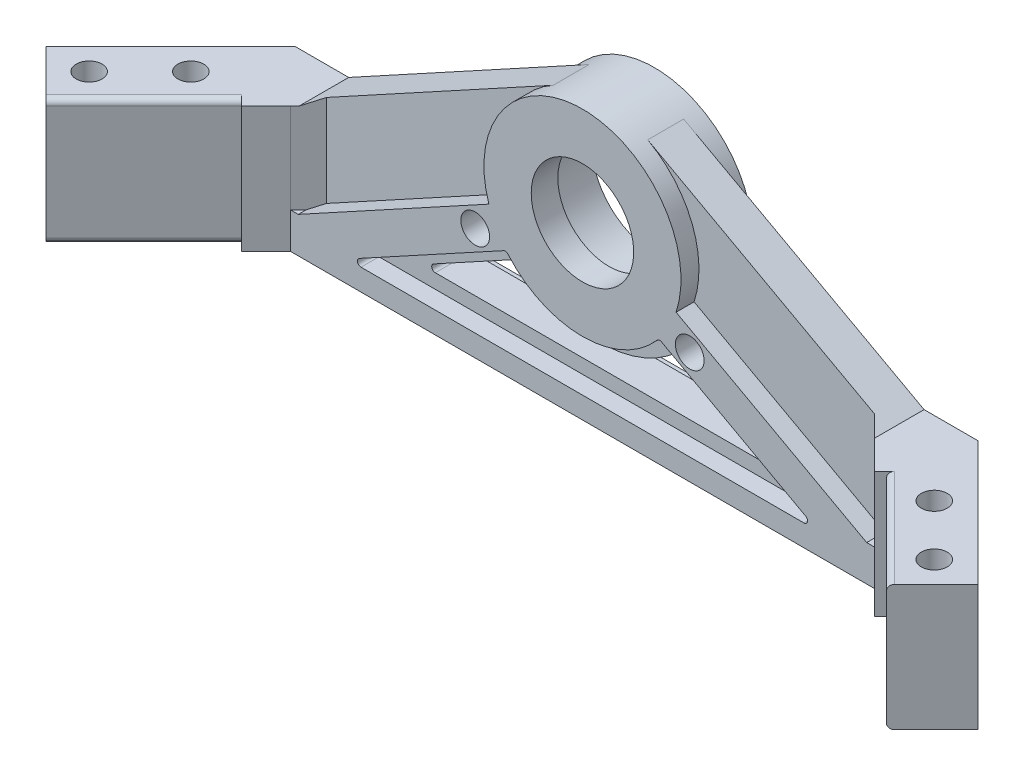
from build123d import *

# Parameters (mm, degrees)
BOSS_EXTRUDE1_DEPTH = 11.1125
BOSS_EXTRUDE2_DEPTH = 12.7
CUT_EXTRUDE2_DEPTH  = 8
CUT_EXTRUDE3_DEPTH  = 96.942967533
SKETCH5_W           = 25.144717139
SKETCH5_H           = 15.875
CUT_EXTRUDE4_DEPTH  = 3.175
CUT_EXTRUDE5_DEPTH  = 96.942967533
SKETCH6_R           = 2.54
CUT_EXTRUDE6_DEPTH  = 96.942967533
CUT_EXTRUDE7_START  = -3.175
CUT_EXTRUDE7_DEPTH  = 3.175
CHAMFER1_SIZE       = 3.175
FILLET1_R           = 0.635
FILLET3_R           = 1.016
SKETCH8_R           = 2.286
CUT_EXTRUDE8_DEPTH  = 93.295392221


with BuildPart() as part:
    # Sketch3 → Boss-Extrude1 (new, symmetric)
    with BuildSketch(Plane(origin=(0, 0, 0), x_dir=(1, 0, 0), z_dir=(0, 1, 0))):
        Polygon((-56.934473853, -15.948934871), (-65.016704362, -7.866704362), (-82.294717139, -25.144717139), (-74.93090712, -32.508527158), (-74.21248663, -33.226947648), align=None)
        Polygon((-65.016704362, -7.866704362), (-55.873813681, -17.009595043), (-52.371513794, -13.507295156), (-61.514404475, -4.364404475), align=None)
        Polygon((-52.371513794, -13.507295156), (-51.564218639, -12.7), (-17.311249955, -12.7), (0, -12.7), (0, 0), (-17.311249955, 0), (-57.15, 0), (-60.325, -3.175), (-61.514404475, -4.364404475), align=None)
        Polygon((0, 0), (0, -12.7), (17.311249955, -12.7), (51.564218639, -12.7), (52.371513794, -13.507295156), (61.514404475, -4.364404475), (60.325, -3.175), (57.15, 0), (17.311249955, 0), align=None)
        Polygon((61.514404475, -4.364404475), (65.016704362, -7.866704362), (55.873813681, -17.009595043), (52.371513794, -13.507295156), align=None)
        Polygon((65.016704362, -7.866704362), (56.934473853, -15.948934871), (74.21248663, -33.226947648), (74.93090712, -32.508527158), (82.294717139, -25.144717139), align=None)
    extrude(amount=BOSS_EXTRUDE1_DEPTH, both=True)

    # Sketch2 → Boss-Extrude2 (add)
    with BuildSketch(Plane.XY):
        with BuildLine():
            Line((-50.804788276, 11.1125), (50.804788276, 11.1125))
            Line((50.804788276, 11.1125), (8.344749207, 34.318436746))
            ThreePointArc((8.344749207, 34.318436746), (0, 36.45), (-8.344749207, 34.318436746))
            Line((-8.344749207, 34.318436746), (-50.804788276, 11.1125))
        make_face()
    extrude(amount=BOSS_EXTRUDE2_DEPTH)

    # Sketch2<3> → Cut-Extrude2 (cut)
    with BuildSketch(Plane.XY):
        with BuildLine():
            ThreePointArc((0, 30.1), (-11.05, 19.05), (0, 8))
            Line((0, 8), (0, 10))
            ThreePointArc((0, 10), (-9.05, 19.05), (0, 28.1))
            Line((0, 28.1), (0, 30.1))
        make_face()
        with BuildLine():
            Line((0, 10), (0, 8))
            ThreePointArc((0, 8), (7.813529932, 11.236470068), (11.05, 19.05))
            ThreePointArc((11.05, 19.05), (7.813529932, 26.863529932), (0, 30.1))
            Line((0, 30.1), (0, 28.1))
            ThreePointArc((0, 28.1), (6.39931637, 25.44931637), (9.05, 19.05))
            ThreePointArc((9.05, 19.05), (6.39931637, 12.65068363), (0, 10))
        make_face()
        with BuildLine():
            ThreePointArc((0, 28.1), (-9.05, 19.05), (0, 10))
            Line((0, 10), (0, 28.1))
        make_face()
        with BuildLine():
            Line((0, 28.1), (0, 10))
            ThreePointArc((0, 10), (6.39931637, 12.65068363), (9.05, 19.05))
            ThreePointArc((9.05, 19.05), (6.39931637, 25.44931637), (0, 28.1))
        make_face()
    extrude(amount=CUT_EXTRUDE2_DEPTH, mode=Mode.SUBTRACT)

    # Sketch2<5> → Cut-Extrude3 (cut, through all)
    with BuildSketch(Plane.XY):
        with BuildLine():
            ThreePointArc((0, 28.1), (-9.05, 19.05), (0, 10))
            Line((0, 10), (0, 28.1))
        make_face()
        with BuildLine():
            Line((0, 28.1), (0, 10))
            ThreePointArc((0, 10), (6.39931637, 12.65068363), (9.05, 19.05))
            ThreePointArc((9.05, 19.05), (6.39931637, 25.44931637), (0, 28.1))
        make_face()
    extrude(amount=CUT_EXTRUDE3_DEPTH, mode=Mode.SUBTRACT)

    # Sketch5 → Cut-Extrude4 (cut)
    # profile 1 of 5: a face of its own
    with BuildSketch(Plane(origin=(0, 0, 0), x_dir=(-1, 0, 0), z_dir=(0, 0, -1))):
        with Locations((-69.72235857, 3.175)):
            Rectangle(SKETCH5_W, SKETCH5_H)
    # profile 2 of 5: a face of its own
    with BuildSketch(Plane(origin=(0, 0, 0), x_dir=(-1, 0, 0), z_dir=(0, 0, -1))):
        with BuildLine():
            Line((-50.190202202, -4.7625), (-16.534774751, 13.631400187))
            ThreePointArc((-16.534774751, 13.631400187), (-16.178258512, 25.454994263), (-8.344749207, 34.318436746))
            Line((-8.344749207, 34.318436746), (-50.804788276, 11.1125))
            Line((-50.804788276, 11.1125), (-57.15, 11.1125))
            Line((-57.15, 11.1125), (-57.15, -4.7625))
            Line((-57.15, -4.7625), (-50.190202202, -4.7625))
        make_face()
    # profile 3 of 5: a face of its own
    with BuildSketch(Plane(origin=(0, 0, 0), x_dir=(-1, 0, 0), z_dir=(0, 0, -1))):
        with BuildLine():
            Line((50.804788276, 11.1125), (8.344749207, 34.318436746))
            ThreePointArc((8.344749207, 34.318436746), (14.965938597, 27.925848236), (17.4, 19.05))
            ThreePointArc((17.4, 19.05), (17.182332215, 16.306378367), (16.534774751, 13.631400187))
            Line((16.534774751, 13.631400187), (50.190202202, -4.7625))
            Line((50.190202202, -4.7625), (57.15, -4.7625))
            Line((57.15, -4.7625), (57.15, 11.1125))
            Line((57.15, 11.1125), (50.804788276, 11.1125))
        make_face()
    # profile 4 of 5: a face of its own
    with BuildSketch(Plane(origin=(0, 0, 0), x_dir=(-1, 0, 0), z_dir=(0, 0, -1))):
        with Locations((69.72235857, 3.175)):
            Rectangle(SKETCH5_W, SKETCH5_H)
    # profile 5 of 5: a face of its own
    with BuildSketch(Plane(origin=(0, 0, 0), x_dir=(-1, 0, 0), z_dir=(0, 0, -1))):
        with BuildLine():
            ThreePointArc((13.489420874, 8.059298271), (0, 1.65), (-13.489420874, 8.059298271))
            Line((-13.489420874, 8.059298271), (-41.5969936, -7.3025))
            Line((-41.5969936, -7.3025), (41.5969936, -7.3025))
            Line((41.5969936, -7.3025), (13.489420874, 8.059298271))
        make_face()
        with BuildLine():
            Line((31.653276027, -4.7625), (-31.653276027, -4.7625))
            Line((-31.653276027, -4.7625), (-14.022402602, 4.873405723))
            ThreePointArc((-14.022402602, 4.873405723), (0, -0.89), (14.022402602, 4.873405723))
            Line((14.022402602, 4.873405723), (31.653276027, -4.7625))
        make_face(mode=Mode.SUBTRACT)
    extrude(amount=-CUT_EXTRUDE4_DEPTH, mode=Mode.SUBTRACT)

    # Sketch5<3> → Cut-Extrude5 (cut, through all)
    with BuildSketch(Plane(origin=(0, 0, 0), x_dir=(-1, 0, 0), z_dir=(0, 0, -1))):
        with BuildLine():
            ThreePointArc((-14.022402602, 4.873405723), (0, -0.89), (14.022402602, 4.873405723))
            Line((14.022402602, 4.873405723), (31.653276027, -4.7625))
            Line((31.653276027, -4.7625), (-31.653276027, -4.7625))
            Line((-31.653276027, -4.7625), (-14.022402602, 4.873405723))
        make_face()
    extrude(amount=-CUT_EXTRUDE5_DEPTH, mode=Mode.SUBTRACT)

    # Sketch6 → Cut-Extrude6 (cut, through all)
    with BuildSketch(Plane(origin=(0, 0, 0), x_dir=(-1, 0, 0), z_dir=(0, 0, -1))):
        with Locations((-18.945146514, 8.695796817)):
            Circle(SKETCH6_R)
        with Locations((18.945146514, 8.695796817)):
            Circle(SKETCH6_R)
    extrude(amount=-CUT_EXTRUDE6_DEPTH, mode=Mode.SUBTRACT)

    # Sketch7 → Cut-Extrude7 (cut)
    # profile 1 of 3: a face of its own
    with BuildSketch(Plane.XY.offset(12.7).offset(CUT_EXTRUDE7_START)):
        with BuildLine():
            ThreePointArc((13.489420874, 8.059298271), (0, 1.65), (-13.489420874, 8.059298271))
            Line((-13.489420874, 8.059298271), (-41.5969936, -7.3025))
            Line((-41.5969936, -7.3025), (41.5969936, -7.3025))
            Line((41.5969936, -7.3025), (13.489420874, 8.059298271))
        make_face()
        with BuildLine():
            Line((-31.653276027, -4.7625), (-14.022402602, 4.873405723))
            ThreePointArc((-14.022402602, 4.873405723), (0, -0.89), (14.022402602, 4.873405723))
            Line((14.022402602, 4.873405723), (31.653276027, -4.7625))
            Line((31.653276027, -4.7625), (-31.653276027, -4.7625))
        make_face(mode=Mode.SUBTRACT)
    # profile 2 of 3: a face of its own
    with BuildSketch(Plane.XY.offset(12.7).offset(CUT_EXTRUDE7_START)):
        with BuildLine():
            Line((-51.564218639, -4.7625), (-50.190202202, -4.7625))
            Line((-50.190202202, -4.7625), (-16.534774751, 13.631400187))
            ThreePointArc((-16.534774751, 13.631400187), (-16.178258512, 25.454994263), (-8.344749207, 34.318436746))
            Line((-8.344749207, 34.318436746), (-50.804788276, 11.1125))
            Line((-50.804788276, 11.1125), (-51.564218639, 11.1125))
            Line((-51.564218639, 11.1125), (-51.564218639, -4.7625))
        make_face()
    # profile 3 of 3: a face of its own
    with BuildSketch(Plane.XY.offset(12.7).offset(CUT_EXTRUDE7_START)):
        with BuildLine():
            Line((50.804788276, 11.1125), (8.344749207, 34.318436746))
            ThreePointArc((8.344749207, 34.318436746), (14.965938597, 27.925848236), (17.4, 19.05))
            ThreePointArc((17.4, 19.05), (17.182332215, 16.306378367), (16.534774751, 13.631400187))
            Line((16.534774751, 13.631400187), (50.190202202, -4.7625))
            Line((50.190202202, -4.7625), (51.564218639, -4.7625))
            Line((51.564218639, -4.7625), (51.564218639, 11.1125))
            Line((51.564218639, 11.1125), (50.804788276, 11.1125))
        make_face()
    extrude(amount=CUT_EXTRUDE7_DEPTH, mode=Mode.SUBTRACT)

    # Chamfer1
    chamfer1_edges = [part.edges().sort_by_distance(p)[0] for p in [
        (51.564218639, 3.175, 9.525),
        (-51.564218639, 3.175, 9.525),
    ]]
    chamfer(chamfer1_edges, length=CHAMFER1_SIZE - 0.0001)  # a hair under: the kernel refuses the full size

    # Fillet1
    fillet1_edges = [part.edges().sort_by_distance(p)[0] for p in [
        (13.489420874, 8.059298271, 1.5875),
        (-13.489420874, 8.059298271, 1.5875),
        (-41.5969936, -7.3025, 1.5875),
        (41.5969936, -7.3025, 1.5875),
        (14.022402602, 4.873405723, 6.35),
        (31.653276027, -4.7625, 6.35),
        (-31.653276027, -4.7625, 6.35),
        (-14.022402602, 4.873405723, 6.35),
        (-13.489420874, 8.059298271, 11.1125),
        (13.489420874, 8.059298271, 11.1125),
        (41.5969936, -7.3025, 11.1125),
        (-41.5969936, -7.3025, 11.1125),
    ]]
    fillet(fillet1_edges, radius=FILLET1_R)

    # Fillet3
    fillet3_edges = [part.edges().sort_by_distance(p)[0] for p in [
        (65.573480242, -11.1125, 24.587941259),
        (-65.573480242, -11.1125, 24.587941259),
        (65.573480242, 11.1125, 24.587941259),
        (-65.573480242, 11.1125, 24.587941259),
    ]]
    fillet(fillet3_edges, radius=FILLET3_R)

    # Sketch8 → Cut-Extrude8 (cut, through all)
    with BuildSketch(Plane(origin=(0, 11.1125, 0), x_dir=(1, 0, 0), z_dir=(0, 1, 0))):
        with Locations(Location((74.625578412, -25.198598676, 0), (0, 0, 270))):
            Circle(SKETCH8_R)
        with Locations(Location((-74.625578412, -25.198598676, 0), (0, 0, 270))):
            Circle(SKETCH8_R)
        with Locations(Location((65.645322291, -16.218342555, 0), (0, 0, 270))):
            Circle(SKETCH8_R)
        with Locations(Location((-65.645322291, -16.218342555, 0), (0, 0, 90))):
            Circle(SKETCH8_R)
    extrude(amount=-CUT_EXTRUDE8_DEPTH, mode=Mode.SUBTRACT)


solid = part.part
